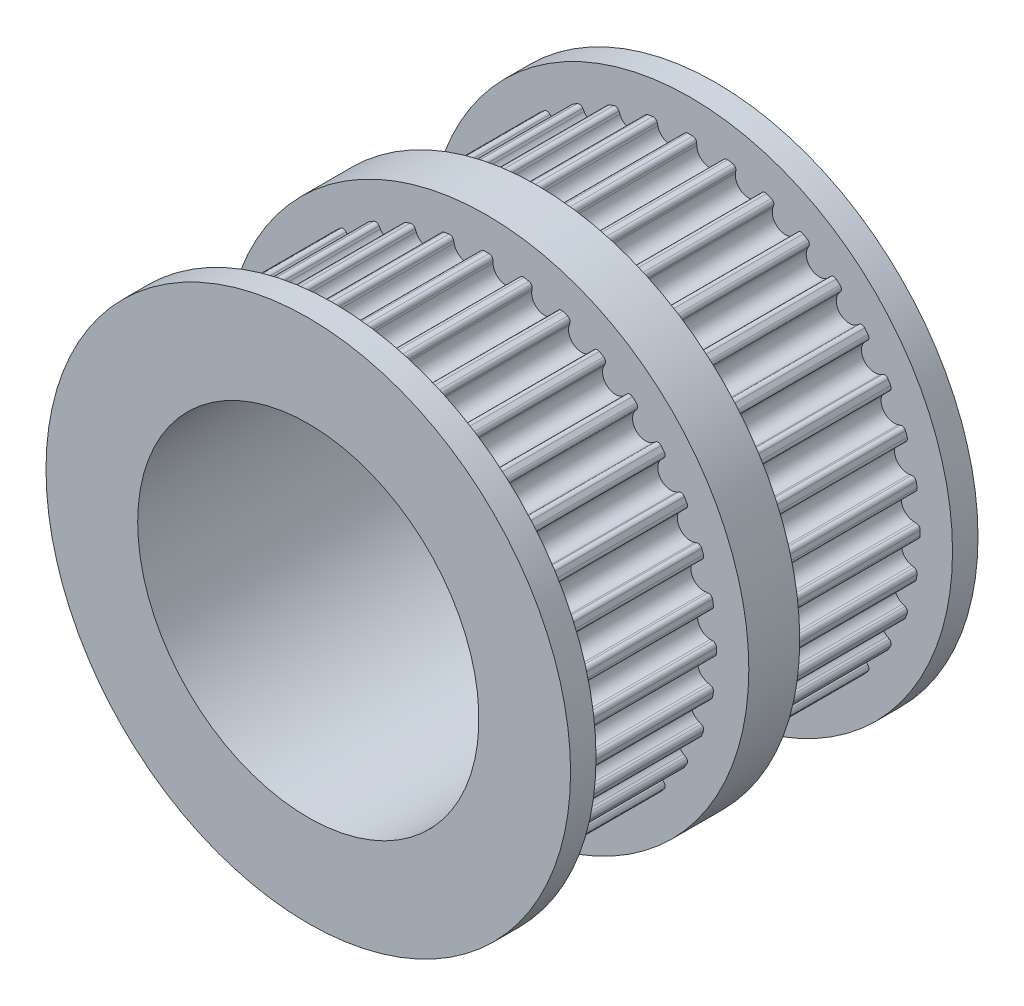
from build123d import *

# Parameters (mm, degrees)
SKETCH2_R             = 45.15
EXTRUDE1_DEPTH        = 30
EXTRUDE2_DEPTH        = 30
CIRPATTERN1_COUNT     = 36
SKETCH5_R             = 51.5
EXTRUDE4_DEPTH        = 10
EXTRUDE5_START        = 5
SKETCH6_R             = 51.5
EXTRUDE5_DEPTH        = 5
MIRROR6_COPY_1_DEPTH  = 30
MIRROR6_COPY_2_DEPTH  = 30
MIRROR6_COPY_3_DEPTH  = 30
MIRROR6_COPY_4_DEPTH  = 30
MIRROR6_COPY_5_DEPTH  = 30
MIRROR6_COPY_6_DEPTH  = 30
MIRROR6_COPY_7_DEPTH  = 30
MIRROR6_COPY_8_DEPTH  = 30
MIRROR6_COPY_9_DEPTH  = 30
MIRROR6_COPY_10_DEPTH = 30
MIRROR6_COPY_11_DEPTH = 30
MIRROR6_COPY_12_DEPTH = 30
MIRROR6_COPY_13_DEPTH = 30
MIRROR6_COPY_14_DEPTH = 30
MIRROR6_COPY_15_DEPTH = 30
MIRROR6_COPY_16_DEPTH = 30
MIRROR6_COPY_17_DEPTH = 30
MIRROR6_COPY_18_DEPTH = 30
MIRROR6_COPY_19_DEPTH = 30
MIRROR6_COPY_20_DEPTH = 30
MIRROR6_COPY_21_DEPTH = 30
MIRROR6_COPY_22_DEPTH = 30
MIRROR6_COPY_23_DEPTH = 30
MIRROR6_COPY_24_DEPTH = 30
MIRROR6_COPY_25_DEPTH = 30
MIRROR6_COPY_26_DEPTH = 30
MIRROR6_COPY_27_DEPTH = 30
MIRROR6_COPY_28_DEPTH = 30
MIRROR6_COPY_29_DEPTH = 30
MIRROR6_COPY_30_DEPTH = 30
MIRROR6_COPY_31_DEPTH = 30
MIRROR6_COPY_32_DEPTH = 30
MIRROR6_COPY_33_DEPTH = 30
MIRROR6_COPY_34_DEPTH = 30
MIRROR6_COPY_35_DEPTH = 30
SKETCH7_R             = 33.5
EXTRUDE6_DEPTH        = 109.187337522


with BuildPart() as part:
    # Sketch2 → Extrude1 (new body)
    with BuildSketch(Plane.XY):
        Circle(SKETCH2_R)
    extrude1 = extrude(amount=EXTRUDE1_DEPTH)

    # Sketch1 → Extrude2 (cut)
    with BuildSketch(Plane.XY):
        with BuildLine():
            Line((-1.265610805, 44.394558923), (-1.282106289, 43.922190055))
            ThreePointArc((-1.282106289, 43.922190055), (-3.626550456, 41.451661388), (-6.364380048, 43.477548716))
            Line((-6.364380048, 43.477548716), (-6.462650922, 43.939876828))
            ThreePointArc((-6.462650922, 43.939876828), (-6.785899963, 44.421956093), (-7.352628199, 44.547293504))
            ThreePointArc((-7.352628199, 44.547293504), (-3.935081785, 44.978190619), (-0.494631081, 45.147290507))
            ThreePointArc((-0.494631081, 45.147290507), (-1.030984829, 44.925445927), (-1.265610805, 44.394558923))
        make_face()
    extrude2 = extrude(amount=EXTRUDE2_DEPTH, mode=Mode.SUBTRACT)

    # CirPattern1: Extrude2 ×36 about axis
    cirpattern1_axis = Axis((0, 0, 30), (0, 0, 1))
    for i in range(1, CIRPATTERN1_COUNT):
        add(extrude2.rotate(cirpattern1_axis, i * 360 / CIRPATTERN1_COUNT), mode=Mode.SUBTRACT)

    # Sketch5 → Extrude4 (add)
    with BuildSketch(Plane.XY.offset(30)):
        Circle(SKETCH5_R)
    extrude(amount=EXTRUDE4_DEPTH)

    # Sketch6 → Extrude5 (add)
    with BuildSketch(Plane(origin=(0, 0, 0), x_dir=(-1, 0, 0), z_dir=(0, 0, -1)).offset(EXTRUDE5_START)):
        Circle(SKETCH6_R)
    extrude5 = extrude(amount=-EXTRUDE5_DEPTH)

    # Mirror6: Extrude1, Extrude2, Extrude5 across plane
    add(extrude1.mirror(Plane.XY.offset(35)))
    add(extrude2.mirror(Plane.XY.offset(35)), mode=Mode.SUBTRACT)
    add(extrude5.mirror(Plane.XY.offset(35)))

    # Mirror6 copy 1 sketch → Mirror6 copy 1 (cut)
    with BuildSketch(Plane(origin=(0, 0, 70), x_dir=(0.984807753012208, 0.17364817766693033, 0), z_dir=(0, 0, -1))):
        with BuildLine():
            Line((-1.265610805, -44.394558923), (-1.282106289, -43.922190055))
            ThreePointArc((-1.282106289, -43.922190055), (-3.626550456, -41.451661388), (-6.364380048, -43.477548716))
            Line((-6.364380048, -43.477548716), (-6.462650922, -43.939876828))
            ThreePointArc((-6.462650922, -43.939876828), (-6.785899963, -44.421956093), (-7.352628199, -44.547293504))
            ThreePointArc((-7.352628199, -44.547293504), (-3.935081785, -44.978190619), (-0.494631081, -45.147290507))
            ThreePointArc((-0.494631081, -45.147290507), (-1.030984829, -44.925445927), (-1.265610805, -44.394558923))
        make_face()
    extrude(amount=MIRROR6_COPY_1_DEPTH, mode=Mode.SUBTRACT)

    # Mirror6 copy 2 sketch → Mirror6 copy 2 (cut)
    with BuildSketch(Plane(origin=(0, 0, 70), x_dir=(0.9396926207859084, 0.3420201433256687, 0), z_dir=(0, 0, -1))):
        with BuildLine():
            Line((-1.265610805, -44.394558923), (-1.282106289, -43.922190055))
            ThreePointArc((-1.282106289, -43.922190055), (-3.626550456, -41.451661388), (-6.364380048, -43.477548716))
            Line((-6.364380048, -43.477548716), (-6.462650922, -43.939876828))
            ThreePointArc((-6.462650922, -43.939876828), (-6.785899963, -44.421956093), (-7.352628199, -44.547293504))
            ThreePointArc((-7.352628199, -44.547293504), (-3.935081785, -44.978190619), (-0.494631081, -45.147290507))
            ThreePointArc((-0.494631081, -45.147290507), (-1.030984829, -44.925445927), (-1.265610805, -44.394558923))
        make_face()
    extrude(amount=MIRROR6_COPY_2_DEPTH, mode=Mode.SUBTRACT)

    # Mirror6 copy 3 sketch → Mirror6 copy 3 (cut)
    with BuildSketch(Plane(origin=(0, 0, 70), x_dir=(0.8660254037844387, 0.49999999999999994, 0), z_dir=(0, 0, -1))):
        with BuildLine():
            Line((-1.265610805, -44.394558923), (-1.282106289, -43.922190055))
            ThreePointArc((-1.282106289, -43.922190055), (-3.626550456, -41.451661388), (-6.364380048, -43.477548716))
            Line((-6.364380048, -43.477548716), (-6.462650922, -43.939876828))
            ThreePointArc((-6.462650922, -43.939876828), (-6.785899963, -44.421956093), (-7.352628199, -44.547293504))
            ThreePointArc((-7.352628199, -44.547293504), (-3.935081785, -44.978190619), (-0.494631081, -45.147290507))
            ThreePointArc((-0.494631081, -45.147290507), (-1.030984829, -44.925445927), (-1.265610805, -44.394558923))
        make_face()
    extrude(amount=MIRROR6_COPY_3_DEPTH, mode=Mode.SUBTRACT)

    # Mirror6 copy 4 sketch → Mirror6 copy 4 (cut)
    with BuildSketch(Plane(origin=(0, 0, 70), x_dir=(0.766044443118978, 0.6427876096865393, 0), z_dir=(0, 0, -1))):
        with BuildLine():
            Line((-1.265610805, -44.394558923), (-1.282106289, -43.922190055))
            ThreePointArc((-1.282106289, -43.922190055), (-3.626550456, -41.451661388), (-6.364380048, -43.477548716))
            Line((-6.364380048, -43.477548716), (-6.462650922, -43.939876828))
            ThreePointArc((-6.462650922, -43.939876828), (-6.785899963, -44.421956093), (-7.352628199, -44.547293504))
            ThreePointArc((-7.352628199, -44.547293504), (-3.935081785, -44.978190619), (-0.494631081, -45.147290507))
            ThreePointArc((-0.494631081, -45.147290507), (-1.030984829, -44.925445927), (-1.265610805, -44.394558923))
        make_face()
    extrude(amount=MIRROR6_COPY_4_DEPTH, mode=Mode.SUBTRACT)

    # Mirror6 copy 5 sketch → Mirror6 copy 5 (cut)
    with BuildSketch(Plane(origin=(0, 0, 70), x_dir=(0.6427876096865394, 0.766044443118978, 0), z_dir=(0, 0, -1))):
        with BuildLine():
            Line((-1.265610805, -44.394558923), (-1.282106289, -43.922190055))
            ThreePointArc((-1.282106289, -43.922190055), (-3.626550456, -41.451661388), (-6.364380048, -43.477548716))
            Line((-6.364380048, -43.477548716), (-6.462650922, -43.939876828))
            ThreePointArc((-6.462650922, -43.939876828), (-6.785899963, -44.421956093), (-7.352628199, -44.547293504))
            ThreePointArc((-7.352628199, -44.547293504), (-3.935081785, -44.978190619), (-0.494631081, -45.147290507))
            ThreePointArc((-0.494631081, -45.147290507), (-1.030984829, -44.925445927), (-1.265610805, -44.394558923))
        make_face()
    extrude(amount=MIRROR6_COPY_5_DEPTH, mode=Mode.SUBTRACT)

    # Mirror6 copy 6 sketch → Mirror6 copy 6 (cut)
    with BuildSketch(Plane(origin=(0, 0, 70), x_dir=(0.5000000000000001, 0.8660254037844386, 0), z_dir=(0, 0, -1))):
        with BuildLine():
            Line((-1.265610805, -44.394558923), (-1.282106289, -43.922190055))
            ThreePointArc((-1.282106289, -43.922190055), (-3.626550456, -41.451661388), (-6.364380048, -43.477548716))
            Line((-6.364380048, -43.477548716), (-6.462650922, -43.939876828))
            ThreePointArc((-6.462650922, -43.939876828), (-6.785899963, -44.421956093), (-7.352628199, -44.547293504))
            ThreePointArc((-7.352628199, -44.547293504), (-3.935081785, -44.978190619), (-0.494631081, -45.147290507))
            ThreePointArc((-0.494631081, -45.147290507), (-1.030984829, -44.925445927), (-1.265610805, -44.394558923))
        make_face()
    extrude(amount=MIRROR6_COPY_6_DEPTH, mode=Mode.SUBTRACT)

    # Mirror6 copy 7 sketch → Mirror6 copy 7 (cut)
    with BuildSketch(Plane(origin=(0, 0, 70), x_dir=(0.3420201433256688, 0.9396926207859083, 0), z_dir=(0, 0, -1))):
        with BuildLine():
            Line((-1.265610805, -44.394558923), (-1.282106289, -43.922190055))
            ThreePointArc((-1.282106289, -43.922190055), (-3.626550456, -41.451661388), (-6.364380048, -43.477548716))
            Line((-6.364380048, -43.477548716), (-6.462650922, -43.939876828))
            ThreePointArc((-6.462650922, -43.939876828), (-6.785899963, -44.421956093), (-7.352628199, -44.547293504))
            ThreePointArc((-7.352628199, -44.547293504), (-3.935081785, -44.978190619), (-0.494631081, -45.147290507))
            ThreePointArc((-0.494631081, -45.147290507), (-1.030984829, -44.925445927), (-1.265610805, -44.394558923))
        make_face()
    extrude(amount=MIRROR6_COPY_7_DEPTH, mode=Mode.SUBTRACT)

    # Mirror6 copy 8 sketch → Mirror6 copy 8 (cut)
    with BuildSketch(Plane(origin=(0, 0, 70), x_dir=(0.17364817766693041, 0.984807753012208, 0), z_dir=(0, 0, -1))):
        with BuildLine():
            Line((-1.265610805, -44.394558923), (-1.282106289, -43.922190055))
            ThreePointArc((-1.282106289, -43.922190055), (-3.626550456, -41.451661388), (-6.364380048, -43.477548716))
            Line((-6.364380048, -43.477548716), (-6.462650922, -43.939876828))
            ThreePointArc((-6.462650922, -43.939876828), (-6.785899963, -44.421956093), (-7.352628199, -44.547293504))
            ThreePointArc((-7.352628199, -44.547293504), (-3.935081785, -44.978190619), (-0.494631081, -45.147290507))
            ThreePointArc((-0.494631081, -45.147290507), (-1.030984829, -44.925445927), (-1.265610805, -44.394558923))
        make_face()
    extrude(amount=MIRROR6_COPY_8_DEPTH, mode=Mode.SUBTRACT)

    # Mirror6 copy 9 sketch → Mirror6 copy 9 (cut)
    with BuildSketch(Plane.YX.offset(-70)):
        with BuildLine():
            Line((-1.265610805, -44.394558923), (-1.282106289, -43.922190055))
            ThreePointArc((-1.282106289, -43.922190055), (-3.626550456, -41.451661388), (-6.364380048, -43.477548716))
            Line((-6.364380048, -43.477548716), (-6.462650922, -43.939876828))
            ThreePointArc((-6.462650922, -43.939876828), (-6.785899963, -44.421956093), (-7.352628199, -44.547293504))
            ThreePointArc((-7.352628199, -44.547293504), (-3.935081785, -44.978190619), (-0.494631081, -45.147290507))
            ThreePointArc((-0.494631081, -45.147290507), (-1.030984829, -44.925445927), (-1.265610805, -44.394558923))
        make_face()
    extrude(amount=MIRROR6_COPY_9_DEPTH, mode=Mode.SUBTRACT)

    # Mirror6 copy 10 sketch → Mirror6 copy 10 (cut)
    with BuildSketch(Plane(origin=(0, 0, 70), x_dir=(-0.1736481776669303, 0.984807753012208, 0), z_dir=(0, 0, -1))):
        with BuildLine():
            Line((-1.265610805, -44.394558923), (-1.282106289, -43.922190055))
            ThreePointArc((-1.282106289, -43.922190055), (-3.626550456, -41.451661388), (-6.364380048, -43.477548716))
            Line((-6.364380048, -43.477548716), (-6.462650922, -43.939876828))
            ThreePointArc((-6.462650922, -43.939876828), (-6.785899963, -44.421956093), (-7.352628199, -44.547293504))
            ThreePointArc((-7.352628199, -44.547293504), (-3.935081785, -44.978190619), (-0.494631081, -45.147290507))
            ThreePointArc((-0.494631081, -45.147290507), (-1.030984829, -44.925445927), (-1.265610805, -44.394558923))
        make_face()
    extrude(amount=MIRROR6_COPY_10_DEPTH, mode=Mode.SUBTRACT)

    # Mirror6 copy 11 sketch → Mirror6 copy 11 (cut)
    with BuildSketch(Plane(origin=(0, 0, 70), x_dir=(-0.3420201433256687, 0.9396926207859084, 0), z_dir=(0, 0, -1))):
        with BuildLine():
            Line((-1.265610805, -44.394558923), (-1.282106289, -43.922190055))
            ThreePointArc((-1.282106289, -43.922190055), (-3.626550456, -41.451661388), (-6.364380048, -43.477548716))
            Line((-6.364380048, -43.477548716), (-6.462650922, -43.939876828))
            ThreePointArc((-6.462650922, -43.939876828), (-6.785899963, -44.421956093), (-7.352628199, -44.547293504))
            ThreePointArc((-7.352628199, -44.547293504), (-3.935081785, -44.978190619), (-0.494631081, -45.147290507))
            ThreePointArc((-0.494631081, -45.147290507), (-1.030984829, -44.925445927), (-1.265610805, -44.394558923))
        make_face()
    extrude(amount=MIRROR6_COPY_11_DEPTH, mode=Mode.SUBTRACT)

    # Mirror6 copy 12 sketch → Mirror6 copy 12 (cut)
    with BuildSketch(Plane(origin=(0, 0, 70), x_dir=(-0.4999999999999998, 0.8660254037844387, 0), z_dir=(0, 0, -1))):
        with BuildLine():
            Line((-1.265610805, -44.394558923), (-1.282106289, -43.922190055))
            ThreePointArc((-1.282106289, -43.922190055), (-3.626550456, -41.451661388), (-6.364380048, -43.477548716))
            Line((-6.364380048, -43.477548716), (-6.462650922, -43.939876828))
            ThreePointArc((-6.462650922, -43.939876828), (-6.785899963, -44.421956093), (-7.352628199, -44.547293504))
            ThreePointArc((-7.352628199, -44.547293504), (-3.935081785, -44.978190619), (-0.494631081, -45.147290507))
            ThreePointArc((-0.494631081, -45.147290507), (-1.030984829, -44.925445927), (-1.265610805, -44.394558923))
        make_face()
    extrude(amount=MIRROR6_COPY_12_DEPTH, mode=Mode.SUBTRACT)

    # Mirror6 copy 13 sketch → Mirror6 copy 13 (cut)
    with BuildSketch(Plane(origin=(0, 0, 70), x_dir=(-0.6427876096865394, 0.766044443118978, 0), z_dir=(0, 0, -1))):
        with BuildLine():
            Line((-1.265610805, -44.394558923), (-1.282106289, -43.922190055))
            ThreePointArc((-1.282106289, -43.922190055), (-3.626550456, -41.451661388), (-6.364380048, -43.477548716))
            Line((-6.364380048, -43.477548716), (-6.462650922, -43.939876828))
            ThreePointArc((-6.462650922, -43.939876828), (-6.785899963, -44.421956093), (-7.352628199, -44.547293504))
            ThreePointArc((-7.352628199, -44.547293504), (-3.935081785, -44.978190619), (-0.494631081, -45.147290507))
            ThreePointArc((-0.494631081, -45.147290507), (-1.030984829, -44.925445927), (-1.265610805, -44.394558923))
        make_face()
    extrude(amount=MIRROR6_COPY_13_DEPTH, mode=Mode.SUBTRACT)

    # Mirror6 copy 14 sketch → Mirror6 copy 14 (cut)
    with BuildSketch(Plane(origin=(0, 0, 70), x_dir=(-0.7660444431189779, 0.6427876096865395, 0), z_dir=(0, 0, -1))):
        with BuildLine():
            Line((-1.265610805, -44.394558923), (-1.282106289, -43.922190055))
            ThreePointArc((-1.282106289, -43.922190055), (-3.626550456, -41.451661388), (-6.364380048, -43.477548716))
            Line((-6.364380048, -43.477548716), (-6.462650922, -43.939876828))
            ThreePointArc((-6.462650922, -43.939876828), (-6.785899963, -44.421956093), (-7.352628199, -44.547293504))
            ThreePointArc((-7.352628199, -44.547293504), (-3.935081785, -44.978190619), (-0.494631081, -45.147290507))
            ThreePointArc((-0.494631081, -45.147290507), (-1.030984829, -44.925445927), (-1.265610805, -44.394558923))
        make_face()
    extrude(amount=MIRROR6_COPY_14_DEPTH, mode=Mode.SUBTRACT)

    # Mirror6 copy 15 sketch → Mirror6 copy 15 (cut)
    with BuildSketch(Plane(origin=(0, 0, 70), x_dir=(-0.8660254037844387, 0.49999999999999994, 0), z_dir=(0, 0, -1))):
        with BuildLine():
            Line((-1.265610805, -44.394558923), (-1.282106289, -43.922190055))
            ThreePointArc((-1.282106289, -43.922190055), (-3.626550456, -41.451661388), (-6.364380048, -43.477548716))
            Line((-6.364380048, -43.477548716), (-6.462650922, -43.939876828))
            ThreePointArc((-6.462650922, -43.939876828), (-6.785899963, -44.421956093), (-7.352628199, -44.547293504))
            ThreePointArc((-7.352628199, -44.547293504), (-3.935081785, -44.978190619), (-0.494631081, -45.147290507))
            ThreePointArc((-0.494631081, -45.147290507), (-1.030984829, -44.925445927), (-1.265610805, -44.394558923))
        make_face()
    extrude(amount=MIRROR6_COPY_15_DEPTH, mode=Mode.SUBTRACT)

    # Mirror6 copy 16 sketch → Mirror6 copy 16 (cut)
    with BuildSketch(Plane(origin=(0, 0, 70), x_dir=(-0.9396926207859083, 0.3420201433256689, 0), z_dir=(0, 0, -1))):
        with BuildLine():
            Line((-1.265610805, -44.394558923), (-1.282106289, -43.922190055))
            ThreePointArc((-1.282106289, -43.922190055), (-3.626550456, -41.451661388), (-6.364380048, -43.477548716))
            Line((-6.364380048, -43.477548716), (-6.462650922, -43.939876828))
            ThreePointArc((-6.462650922, -43.939876828), (-6.785899963, -44.421956093), (-7.352628199, -44.547293504))
            ThreePointArc((-7.352628199, -44.547293504), (-3.935081785, -44.978190619), (-0.494631081, -45.147290507))
            ThreePointArc((-0.494631081, -45.147290507), (-1.030984829, -44.925445927), (-1.265610805, -44.394558923))
        make_face()
    extrude(amount=MIRROR6_COPY_16_DEPTH, mode=Mode.SUBTRACT)

    # Mirror6 copy 17 sketch → Mirror6 copy 17 (cut)
    with BuildSketch(Plane(origin=(0, 0, 70), x_dir=(-0.984807753012208, 0.17364817766693028, 0), z_dir=(0, 0, -1))):
        with BuildLine():
            Line((-1.265610805, -44.394558923), (-1.282106289, -43.922190055))
            ThreePointArc((-1.282106289, -43.922190055), (-3.626550456, -41.451661388), (-6.364380048, -43.477548716))
            Line((-6.364380048, -43.477548716), (-6.462650922, -43.939876828))
            ThreePointArc((-6.462650922, -43.939876828), (-6.785899963, -44.421956093), (-7.352628199, -44.547293504))
            ThreePointArc((-7.352628199, -44.547293504), (-3.935081785, -44.978190619), (-0.494631081, -45.147290507))
            ThreePointArc((-0.494631081, -45.147290507), (-1.030984829, -44.925445927), (-1.265610805, -44.394558923))
        make_face()
    extrude(amount=MIRROR6_COPY_17_DEPTH, mode=Mode.SUBTRACT)

    # Mirror6 copy 18 sketch → Mirror6 copy 18 (cut)
    with BuildSketch(Plane(origin=(0, 0, 70), x_dir=(-1, 0, 0), z_dir=(0, 0, -1))):
        with BuildLine():
            Line((-1.265610805, -44.394558923), (-1.282106289, -43.922190055))
            ThreePointArc((-1.282106289, -43.922190055), (-3.626550456, -41.451661388), (-6.364380048, -43.477548716))
            Line((-6.364380048, -43.477548716), (-6.462650922, -43.939876828))
            ThreePointArc((-6.462650922, -43.939876828), (-6.785899963, -44.421956093), (-7.352628199, -44.547293504))
            ThreePointArc((-7.352628199, -44.547293504), (-3.935081785, -44.978190619), (-0.494631081, -45.147290507))
            ThreePointArc((-0.494631081, -45.147290507), (-1.030984829, -44.925445927), (-1.265610805, -44.394558923))
        make_face()
    extrude(amount=MIRROR6_COPY_18_DEPTH, mode=Mode.SUBTRACT)

    # Mirror6 copy 19 sketch → Mirror6 copy 19 (cut)
    with BuildSketch(Plane(origin=(0, 0, 70), x_dir=(-0.984807753012208, -0.17364817766693047, 0), z_dir=(0, 0, -1))):
        with BuildLine():
            Line((-1.265610805, -44.394558923), (-1.282106289, -43.922190055))
            ThreePointArc((-1.282106289, -43.922190055), (-3.626550456, -41.451661388), (-6.364380048, -43.477548716))
            Line((-6.364380048, -43.477548716), (-6.462650922, -43.939876828))
            ThreePointArc((-6.462650922, -43.939876828), (-6.785899963, -44.421956093), (-7.352628199, -44.547293504))
            ThreePointArc((-7.352628199, -44.547293504), (-3.935081785, -44.978190619), (-0.494631081, -45.147290507))
            ThreePointArc((-0.494631081, -45.147290507), (-1.030984829, -44.925445927), (-1.265610805, -44.394558923))
        make_face()
    extrude(amount=MIRROR6_COPY_19_DEPTH, mode=Mode.SUBTRACT)

    # Mirror6 copy 20 sketch → Mirror6 copy 20 (cut)
    with BuildSketch(Plane(origin=(0, 0, 70), x_dir=(-0.9396926207859084, -0.34202014332566866, 0), z_dir=(0, 0, -1))):
        with BuildLine():
            Line((-1.265610805, -44.394558923), (-1.282106289, -43.922190055))
            ThreePointArc((-1.282106289, -43.922190055), (-3.626550456, -41.451661388), (-6.364380048, -43.477548716))
            Line((-6.364380048, -43.477548716), (-6.462650922, -43.939876828))
            ThreePointArc((-6.462650922, -43.939876828), (-6.785899963, -44.421956093), (-7.352628199, -44.547293504))
            ThreePointArc((-7.352628199, -44.547293504), (-3.935081785, -44.978190619), (-0.494631081, -45.147290507))
            ThreePointArc((-0.494631081, -45.147290507), (-1.030984829, -44.925445927), (-1.265610805, -44.394558923))
        make_face()
    extrude(amount=MIRROR6_COPY_20_DEPTH, mode=Mode.SUBTRACT)

    # Mirror6 copy 21 sketch → Mirror6 copy 21 (cut)
    with BuildSketch(Plane(origin=(0, 0, 70), x_dir=(-0.8660254037844386, -0.5000000000000001, 0), z_dir=(0, 0, -1))):
        with BuildLine():
            Line((-1.265610805, -44.394558923), (-1.282106289, -43.922190055))
            ThreePointArc((-1.282106289, -43.922190055), (-3.626550456, -41.451661388), (-6.364380048, -43.477548716))
            Line((-6.364380048, -43.477548716), (-6.462650922, -43.939876828))
            ThreePointArc((-6.462650922, -43.939876828), (-6.785899963, -44.421956093), (-7.352628199, -44.547293504))
            ThreePointArc((-7.352628199, -44.547293504), (-3.935081785, -44.978190619), (-0.494631081, -45.147290507))
            ThreePointArc((-0.494631081, -45.147290507), (-1.030984829, -44.925445927), (-1.265610805, -44.394558923))
        make_face()
    extrude(amount=MIRROR6_COPY_21_DEPTH, mode=Mode.SUBTRACT)

    # Mirror6 copy 22 sketch → Mirror6 copy 22 (cut)
    with BuildSketch(Plane(origin=(0, 0, 70), x_dir=(-0.766044443118978, -0.6427876096865393, 0), z_dir=(0, 0, -1))):
        with BuildLine():
            Line((-1.265610805, -44.394558923), (-1.282106289, -43.922190055))
            ThreePointArc((-1.282106289, -43.922190055), (-3.626550456, -41.451661388), (-6.364380048, -43.477548716))
            Line((-6.364380048, -43.477548716), (-6.462650922, -43.939876828))
            ThreePointArc((-6.462650922, -43.939876828), (-6.785899963, -44.421956093), (-7.352628199, -44.547293504))
            ThreePointArc((-7.352628199, -44.547293504), (-3.935081785, -44.978190619), (-0.494631081, -45.147290507))
            ThreePointArc((-0.494631081, -45.147290507), (-1.030984829, -44.925445927), (-1.265610805, -44.394558923))
        make_face()
    extrude(amount=MIRROR6_COPY_22_DEPTH, mode=Mode.SUBTRACT)

    # Mirror6 copy 23 sketch → Mirror6 copy 23 (cut)
    with BuildSketch(Plane(origin=(0, 0, 70), x_dir=(-0.6427876096865395, -0.7660444431189779, 0), z_dir=(0, 0, -1))):
        with BuildLine():
            Line((-1.265610805, -44.394558923), (-1.282106289, -43.922190055))
            ThreePointArc((-1.282106289, -43.922190055), (-3.626550456, -41.451661388), (-6.364380048, -43.477548716))
            Line((-6.364380048, -43.477548716), (-6.462650922, -43.939876828))
            ThreePointArc((-6.462650922, -43.939876828), (-6.785899963, -44.421956093), (-7.352628199, -44.547293504))
            ThreePointArc((-7.352628199, -44.547293504), (-3.935081785, -44.978190619), (-0.494631081, -45.147290507))
            ThreePointArc((-0.494631081, -45.147290507), (-1.030984829, -44.925445927), (-1.265610805, -44.394558923))
        make_face()
    extrude(amount=MIRROR6_COPY_23_DEPTH, mode=Mode.SUBTRACT)

    # Mirror6 copy 24 sketch → Mirror6 copy 24 (cut)
    with BuildSketch(Plane(origin=(0, 0, 70), x_dir=(-0.5000000000000004, -0.8660254037844384, 0), z_dir=(0, 0, -1))):
        with BuildLine():
            Line((-1.265610805, -44.394558923), (-1.282106289, -43.922190055))
            ThreePointArc((-1.282106289, -43.922190055), (-3.626550456, -41.451661388), (-6.364380048, -43.477548716))
            Line((-6.364380048, -43.477548716), (-6.462650922, -43.939876828))
            ThreePointArc((-6.462650922, -43.939876828), (-6.785899963, -44.421956093), (-7.352628199, -44.547293504))
            ThreePointArc((-7.352628199, -44.547293504), (-3.935081785, -44.978190619), (-0.494631081, -45.147290507))
            ThreePointArc((-0.494631081, -45.147290507), (-1.030984829, -44.925445927), (-1.265610805, -44.394558923))
        make_face()
    extrude(amount=MIRROR6_COPY_24_DEPTH, mode=Mode.SUBTRACT)

    # Mirror6 copy 25 sketch → Mirror6 copy 25 (cut)
    with BuildSketch(Plane(origin=(0, 0, 70), x_dir=(-0.34202014332566855, -0.9396926207859084, 0), z_dir=(0, 0, -1))):
        with BuildLine():
            Line((-1.265610805, -44.394558923), (-1.282106289, -43.922190055))
            ThreePointArc((-1.282106289, -43.922190055), (-3.626550456, -41.451661388), (-6.364380048, -43.477548716))
            Line((-6.364380048, -43.477548716), (-6.462650922, -43.939876828))
            ThreePointArc((-6.462650922, -43.939876828), (-6.785899963, -44.421956093), (-7.352628199, -44.547293504))
            ThreePointArc((-7.352628199, -44.547293504), (-3.935081785, -44.978190619), (-0.494631081, -45.147290507))
            ThreePointArc((-0.494631081, -45.147290507), (-1.030984829, -44.925445927), (-1.265610805, -44.394558923))
        make_face()
    extrude(amount=MIRROR6_COPY_25_DEPTH, mode=Mode.SUBTRACT)

    # Mirror6 copy 26 sketch → Mirror6 copy 26 (cut)
    with BuildSketch(Plane(origin=(0, 0, 70), x_dir=(-0.17364817766693033, -0.984807753012208, 0), z_dir=(0, 0, -1))):
        with BuildLine():
            Line((-1.265610805, -44.394558923), (-1.282106289, -43.922190055))
            ThreePointArc((-1.282106289, -43.922190055), (-3.626550456, -41.451661388), (-6.364380048, -43.477548716))
            Line((-6.364380048, -43.477548716), (-6.462650922, -43.939876828))
            ThreePointArc((-6.462650922, -43.939876828), (-6.785899963, -44.421956093), (-7.352628199, -44.547293504))
            ThreePointArc((-7.352628199, -44.547293504), (-3.935081785, -44.978190619), (-0.494631081, -45.147290507))
            ThreePointArc((-0.494631081, -45.147290507), (-1.030984829, -44.925445927), (-1.265610805, -44.394558923))
        make_face()
    extrude(amount=MIRROR6_COPY_26_DEPTH, mode=Mode.SUBTRACT)

    # Mirror6 copy 27 sketch → Mirror6 copy 27 (cut)
    with BuildSketch(Plane(origin=(0, 0, 70), x_dir=(0, -1, 0), z_dir=(0, 0, -1))):
        with BuildLine():
            Line((-1.265610805, -44.394558923), (-1.282106289, -43.922190055))
            ThreePointArc((-1.282106289, -43.922190055), (-3.626550456, -41.451661388), (-6.364380048, -43.477548716))
            Line((-6.364380048, -43.477548716), (-6.462650922, -43.939876828))
            ThreePointArc((-6.462650922, -43.939876828), (-6.785899963, -44.421956093), (-7.352628199, -44.547293504))
            ThreePointArc((-7.352628199, -44.547293504), (-3.935081785, -44.978190619), (-0.494631081, -45.147290507))
            ThreePointArc((-0.494631081, -45.147290507), (-1.030984829, -44.925445927), (-1.265610805, -44.394558923))
        make_face()
    extrude(amount=MIRROR6_COPY_27_DEPTH, mode=Mode.SUBTRACT)

    # Mirror6 copy 28 sketch → Mirror6 copy 28 (cut)
    with BuildSketch(Plane(origin=(0, 0, 70), x_dir=(0.17364817766692997, -0.9848077530122081, 0), z_dir=(0, 0, -1))):
        with BuildLine():
            Line((-1.265610805, -44.394558923), (-1.282106289, -43.922190055))
            ThreePointArc((-1.282106289, -43.922190055), (-3.626550456, -41.451661388), (-6.364380048, -43.477548716))
            Line((-6.364380048, -43.477548716), (-6.462650922, -43.939876828))
            ThreePointArc((-6.462650922, -43.939876828), (-6.785899963, -44.421956093), (-7.352628199, -44.547293504))
            ThreePointArc((-7.352628199, -44.547293504), (-3.935081785, -44.978190619), (-0.494631081, -45.147290507))
            ThreePointArc((-0.494631081, -45.147290507), (-1.030984829, -44.925445927), (-1.265610805, -44.394558923))
        make_face()
    extrude(amount=MIRROR6_COPY_28_DEPTH, mode=Mode.SUBTRACT)

    # Mirror6 copy 29 sketch → Mirror6 copy 29 (cut)
    with BuildSketch(Plane(origin=(0, 0, 70), x_dir=(0.342020143325669, -0.9396926207859083, 0), z_dir=(0, 0, -1))):
        with BuildLine():
            Line((-1.265610805, -44.394558923), (-1.282106289, -43.922190055))
            ThreePointArc((-1.282106289, -43.922190055), (-3.626550456, -41.451661388), (-6.364380048, -43.477548716))
            Line((-6.364380048, -43.477548716), (-6.462650922, -43.939876828))
            ThreePointArc((-6.462650922, -43.939876828), (-6.785899963, -44.421956093), (-7.352628199, -44.547293504))
            ThreePointArc((-7.352628199, -44.547293504), (-3.935081785, -44.978190619), (-0.494631081, -45.147290507))
            ThreePointArc((-0.494631081, -45.147290507), (-1.030984829, -44.925445927), (-1.265610805, -44.394558923))
        make_face()
    extrude(amount=MIRROR6_COPY_29_DEPTH, mode=Mode.SUBTRACT)

    # Mirror6 copy 30 sketch → Mirror6 copy 30 (cut)
    with BuildSketch(Plane(origin=(0, 0, 70), x_dir=(0.5000000000000001, -0.8660254037844386, 0), z_dir=(0, 0, -1))):
        with BuildLine():
            Line((-1.265610805, -44.394558923), (-1.282106289, -43.922190055))
            ThreePointArc((-1.282106289, -43.922190055), (-3.626550456, -41.451661388), (-6.364380048, -43.477548716))
            Line((-6.364380048, -43.477548716), (-6.462650922, -43.939876828))
            ThreePointArc((-6.462650922, -43.939876828), (-6.785899963, -44.421956093), (-7.352628199, -44.547293504))
            ThreePointArc((-7.352628199, -44.547293504), (-3.935081785, -44.978190619), (-0.494631081, -45.147290507))
            ThreePointArc((-0.494631081, -45.147290507), (-1.030984829, -44.925445927), (-1.265610805, -44.394558923))
        make_face()
    extrude(amount=MIRROR6_COPY_30_DEPTH, mode=Mode.SUBTRACT)

    # Mirror6 copy 31 sketch → Mirror6 copy 31 (cut)
    with BuildSketch(Plane(origin=(0, 0, 70), x_dir=(0.6427876096865393, -0.7660444431189781, 0), z_dir=(0, 0, -1))):
        with BuildLine():
            Line((-1.265610805, -44.394558923), (-1.282106289, -43.922190055))
            ThreePointArc((-1.282106289, -43.922190055), (-3.626550456, -41.451661388), (-6.364380048, -43.477548716))
            Line((-6.364380048, -43.477548716), (-6.462650922, -43.939876828))
            ThreePointArc((-6.462650922, -43.939876828), (-6.785899963, -44.421956093), (-7.352628199, -44.547293504))
            ThreePointArc((-7.352628199, -44.547293504), (-3.935081785, -44.978190619), (-0.494631081, -45.147290507))
            ThreePointArc((-0.494631081, -45.147290507), (-1.030984829, -44.925445927), (-1.265610805, -44.394558923))
        make_face()
    extrude(amount=MIRROR6_COPY_31_DEPTH, mode=Mode.SUBTRACT)

    # Mirror6 copy 32 sketch → Mirror6 copy 32 (cut)
    with BuildSketch(Plane(origin=(0, 0, 70), x_dir=(0.7660444431189778, -0.6427876096865396, 0), z_dir=(0, 0, -1))):
        with BuildLine():
            Line((-1.265610805, -44.394558923), (-1.282106289, -43.922190055))
            ThreePointArc((-1.282106289, -43.922190055), (-3.626550456, -41.451661388), (-6.364380048, -43.477548716))
            Line((-6.364380048, -43.477548716), (-6.462650922, -43.939876828))
            ThreePointArc((-6.462650922, -43.939876828), (-6.785899963, -44.421956093), (-7.352628199, -44.547293504))
            ThreePointArc((-7.352628199, -44.547293504), (-3.935081785, -44.978190619), (-0.494631081, -45.147290507))
            ThreePointArc((-0.494631081, -45.147290507), (-1.030984829, -44.925445927), (-1.265610805, -44.394558923))
        make_face()
    extrude(amount=MIRROR6_COPY_32_DEPTH, mode=Mode.SUBTRACT)

    # Mirror6 copy 33 sketch → Mirror6 copy 33 (cut)
    with BuildSketch(Plane(origin=(0, 0, 70), x_dir=(0.8660254037844384, -0.5000000000000004, 0), z_dir=(0, 0, -1))):
        with BuildLine():
            Line((-1.265610805, -44.394558923), (-1.282106289, -43.922190055))
            ThreePointArc((-1.282106289, -43.922190055), (-3.626550456, -41.451661388), (-6.364380048, -43.477548716))
            Line((-6.364380048, -43.477548716), (-6.462650922, -43.939876828))
            ThreePointArc((-6.462650922, -43.939876828), (-6.785899963, -44.421956093), (-7.352628199, -44.547293504))
            ThreePointArc((-7.352628199, -44.547293504), (-3.935081785, -44.978190619), (-0.494631081, -45.147290507))
            ThreePointArc((-0.494631081, -45.147290507), (-1.030984829, -44.925445927), (-1.265610805, -44.394558923))
        make_face()
    extrude(amount=MIRROR6_COPY_33_DEPTH, mode=Mode.SUBTRACT)

    # Mirror6 copy 34 sketch → Mirror6 copy 34 (cut)
    with BuildSketch(Plane(origin=(0, 0, 70), x_dir=(0.9396926207859084, -0.3420201433256686, 0), z_dir=(0, 0, -1))):
        with BuildLine():
            Line((-1.265610805, -44.394558923), (-1.282106289, -43.922190055))
            ThreePointArc((-1.282106289, -43.922190055), (-3.626550456, -41.451661388), (-6.364380048, -43.477548716))
            Line((-6.364380048, -43.477548716), (-6.462650922, -43.939876828))
            ThreePointArc((-6.462650922, -43.939876828), (-6.785899963, -44.421956093), (-7.352628199, -44.547293504))
            ThreePointArc((-7.352628199, -44.547293504), (-3.935081785, -44.978190619), (-0.494631081, -45.147290507))
            ThreePointArc((-0.494631081, -45.147290507), (-1.030984829, -44.925445927), (-1.265610805, -44.394558923))
        make_face()
    extrude(amount=MIRROR6_COPY_34_DEPTH, mode=Mode.SUBTRACT)

    # Mirror6 copy 35 sketch → Mirror6 copy 35 (cut)
    with BuildSketch(Plane(origin=(0, 0, 70), x_dir=(0.984807753012208, -0.1736481776669304, 0), z_dir=(0, 0, -1))):
        with BuildLine():
            Line((-1.265610805, -44.394558923), (-1.282106289, -43.922190055))
            ThreePointArc((-1.282106289, -43.922190055), (-3.626550456, -41.451661388), (-6.364380048, -43.477548716))
            Line((-6.364380048, -43.477548716), (-6.462650922, -43.939876828))
            ThreePointArc((-6.462650922, -43.939876828), (-6.785899963, -44.421956093), (-7.352628199, -44.547293504))
            ThreePointArc((-7.352628199, -44.547293504), (-3.935081785, -44.978190619), (-0.494631081, -45.147290507))
            ThreePointArc((-0.494631081, -45.147290507), (-1.030984829, -44.925445927), (-1.265610805, -44.394558923))
        make_face()
    extrude(amount=MIRROR6_COPY_35_DEPTH, mode=Mode.SUBTRACT)

    # Sketch7 → Extrude6 (cut, through all)
    with BuildSketch(Plane(origin=(0, 0, -5), x_dir=(-1, 0, 0), z_dir=(0, 0, -1))):
        Circle(SKETCH7_R)
    extrude(amount=-EXTRUDE6_DEPTH, mode=Mode.SUBTRACT)


solid = part.part
